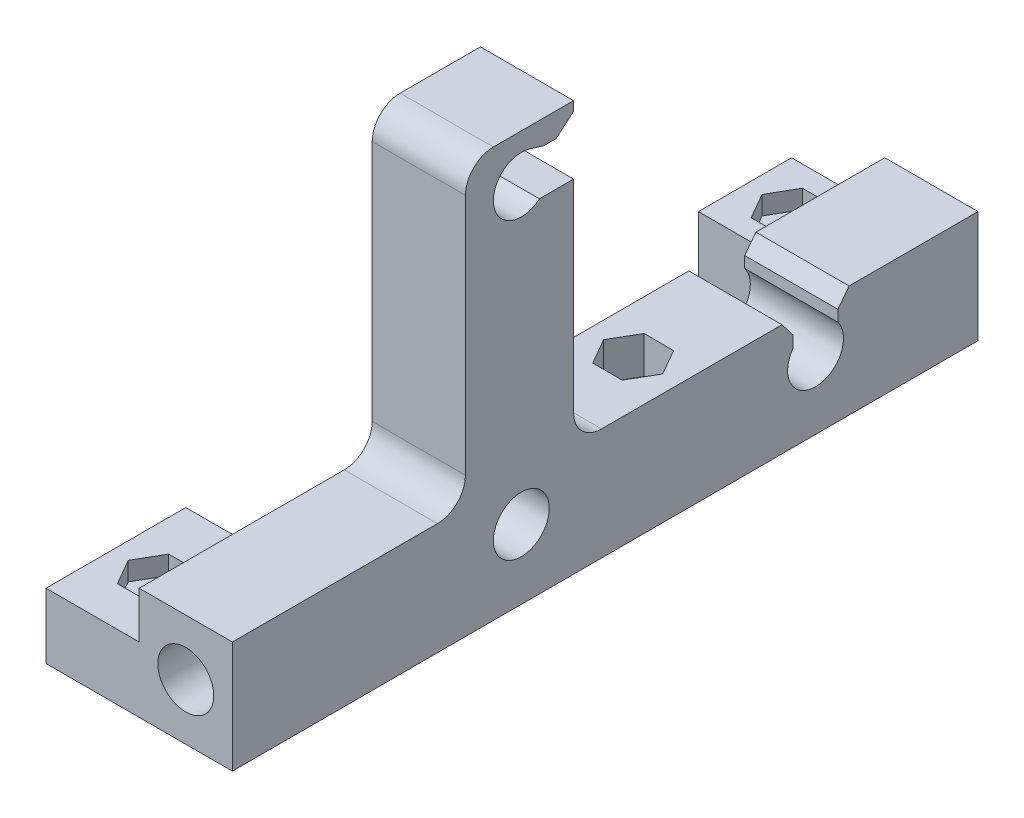
from build123d import *

# Parameters (mm, degrees)
ESBO_O1_R                          = 3
RESSALTO_EXTRUS_O1_DEPTH           = 10
ESBO_O2_R                          = 3
CORTE_EXTRUS_O1_DEPTH              = 20
CORTE_EXTRUS_O2_START              = -70
ESBO_O2_2_R                        = 3
CORTE_EXTRUS_O2_DEPTH              = 10
FILETE1_R                          = 3
ESBO_O3_W                          = 15
ESBO_O3_H                          = 12
ESBO_O3_W_2                        = 10
RESSALTO_EXTRUS_O2_DEPTH           = 10
ESBO_O4_R                          = 1.5
CORTE_EXTRUS_O3_DEPTH              = 15
PADR_O_LINEAR1_COUNT               = 2
PADR_O_LINEAR1_PITCH               = 68
ESBO_O5_R                          = 3
CORTE_EXTRUS_O4_DEPTH              = 63.737548565
CORPO_MOVER_COPIAR1_OUTLINE_R      = 3
CORPO_MOVER_COPIAR1_DEPTH          = 10
CORPO_MOVER_COPIAR1_START          = -10
CORPO_MOVER_COPIAR1_2_OUTLINE_W    = 12
CORPO_MOVER_COPIAR1_2_OUTLINE_H    = 5
CORPO_MOVER_COPIAR1_2_DEPTH        = 11.9999999
CORPO_MOVER_COPIAR1_START_2        = 7.999555429
CORPO_MOVER_COPIAR1_3_DEPTH        = 2.000444571
CORPO_MOVER_COPIAR1_4_DEPTH        = 1.9999999
CORPO_MOVER_COPIAR1_START_3        = -15
CORPO_MOVER_COPIAR1_5_OUTLINE_W    = 10
CORPO_MOVER_COPIAR1_5_OUTLINE_H    = 12
CORPO_MOVER_COPIAR1_5_DEPTH        = 11.608984939
CORPO_MOVER_COPIAR1_START_4        = 15
CORPO_MOVER_COPIAR1_6_OUTLINE_W    = 10
CORPO_MOVER_COPIAR1_6_OUTLINE_H    = 12
CORPO_MOVER_COPIAR1_6_OUTLINE_R    = 3
CORPO_MOVER_COPIAR1_6_DEPTH        = 11.17
CORPO_MOVER_COPIAR1_START_5        = 25
CORPO_MOVER_COPIAR1_7_OUTLINE_W    = 10
CORPO_MOVER_COPIAR1_7_OUTLINE_H    = 12
CORPO_MOVER_COPIAR1_7_DEPTH        = 5
CORPO_MOVER_COPIAR1_START_6        = -30
CORPO_MOVER_COPIAR1_8_OUTLINE_R    = 3
CORPO_MOVER_COPIAR1_8_DEPTH        = 3.5411
CORPO_MOVER_COPIAR1_START_7        = 19.57
CORPO_MOVER_COPIAR1_9_OUTLINE_R    = 3
CORPO_MOVER_COPIAR1_9_DEPTH        = 0.43
CORPO_MOVER_COPIAR1_10_OUTLINE_W   = 10
CORPO_MOVER_COPIAR1_10_OUTLINE_H   = 5
CORPO_MOVER_COPIAR1_10_DEPTH       = 12
CORPO_MOVER_COPIAR1_11_OUTLINE_R   = 3
CORPO_MOVER_COPIAR1_11_DEPTH       = 20
CORPO_MOVER_COPIAR1_12_DEPTH       = 10
CORPO_MOVER_COPIAR1_13_OUTLINE_W   = 10
CORPO_MOVER_COPIAR1_13_OUTLINE_H   = 12
CORPO_MOVER_COPIAR1_13_OUTLINE_H_2 = 32
CORPO_MOVER_COPIAR1_13_DEPTH       = 26.608984939
CORPO_MOVER_COPIAR1_START_8        = 20
CORPO_MOVER_COPIAR1_14_OUTLINE_R   = 3
CORPO_MOVER_COPIAR1_14_DEPTH       = 10
CORPO_MOVER_COPIAR1_15_OUTLINE_W   = 10
CORPO_MOVER_COPIAR1_15_OUTLINE_H   = 5
CORPO_MOVER_COPIAR1_15_DEPTH       = 12
CORTE_EXTRUS_O5_START              = -5
ESBO_O6_W                          = 10
ESBO_O6_H                          = 15
ESBO_O6_H_2                        = 10
ESBO_O6_R                          = 1.5
CORTE_EXTRUS_O5_DEPTH              = 5
CORTE_EXTRUS_O6_START              = -7
ESBO_O6_3_R                        = 1.5
CORTE_EXTRUS_O6_DEPTH              = 7
ESBO_O7_R                          = 1.5
CORTE_EXTRUS_O7_DEPTH              = 53.191953422
ESBO_O7_3_R                        = 1.5
CORTE_EXTRUS_O8_DEPTH              = 4


# Read off the part's stored shape, not the designer's step: Corpo-Mover/Copiar1
with BuildPart() as part:
    # Esboço1 → Ressalto-extrusão1 (new body)
    with BuildSketch(Plane(origin=(0, 0, 0), x_dir=(0, 0, -1), z_dir=(1, 0, 0))):
        with BuildLine():
            Line((15, 44), (3.391015061, 44))
            Line((3.391015061, 44), (3.391015061, 43.011133206))
            Line((3.391015061, 43.011133206), (5.263619021, 41.411133206))
            Line((5.263619021, 41.411133206), (6.571620064, 41.411133206))
            Line((6.571620064, 41.411133206), (8.150645936, 41.877255233))
            ThreePointArc((8.150645936, 41.877255233), (11.934972998, 38.378764538), (7.057683257, 36.713647956))
            Line((7.057683257, 36.713647956), (3.391015061, 36.713647956))
            Line((3.391015061, 36.713647956), (3.391015061, 12))
            Line((3.391015061, 12), (-40, 12))
            Line((-40, 12), (-40, 0))
            Line((-40, 0), (40, 0))
            Line((40, 0), (40, 12))
            Line((40, 12), (15, 12))
            Line((15, 12), (15, 44))
        make_face()
        with Locations((9, 7.43)):
            Circle(ESBO_O1_R, mode=Mode.SUBTRACT)
    extrude(amount=RESSALTO_EXTRUS_O1_DEPTH)

    # Esboço2 → Corte-extrusão1 (cut)
    with BuildSketch(Plane(origin=(0, 0, -40), x_dir=(-1, 0, 0), z_dir=(0, 0, -1))):
        with Locations((-5, 6)):
            Circle(ESBO_O2_R)
    extrude(amount=-CORTE_EXTRUS_O1_DEPTH, mode=Mode.SUBTRACT)

    # Esboço2<2> → Corte-extrusão2 (cut)
    with BuildSketch(Plane(origin=(0, 0, -40), x_dir=(-1, 0, 0), z_dir=(0, 0, -1)).offset(CORTE_EXTRUS_O2_START)):
        with Locations((-5, 6)):
            Circle(ESBO_O2_2_R)
    extrude(amount=-CORTE_EXTRUS_O2_DEPTH, mode=Mode.SUBTRACT)

    # Filete1
    filete1_edges = [part.edges().sort_by_distance(p)[0] for p in [
        (5, 12, -3.391015061),
        (5, 44, -15),
        (5, 12, -15),
    ]]
    fillet(filete1_edges, radius=FILETE1_R)

    # Esboço3 → Ressalto-extrusão2 (add)
    with BuildSketch(Plane.ZY):
        with Locations((-32.5, 6)):
            Rectangle(ESBO_O3_W, ESBO_O3_H)
        with Locations((35, 6)):
            Rectangle(ESBO_O3_W_2, ESBO_O3_H)
    extrude(amount=RESSALTO_EXTRUS_O2_DEPTH)

    # Esboço4 → Corte-extrusão3 (cut)
    with BuildSketch(Plane(origin=(0, 12, 0), x_dir=(1, 0, 0), z_dir=(0, 1, 0))):
        with Locations(Location((-5, 33, 0), (0, 0, 270))):
            Circle(ESBO_O4_R)
    corte_extrus_o3 = extrude(amount=-CORTE_EXTRUS_O3_DEPTH, mode=Mode.SUBTRACT)

    # Padrão linear1: Corte-extrusão3 ×2
    with Locations(*[(0, 0, i * PADR_O_LINEAR1_PITCH) for i in range(1, PADR_O_LINEAR1_COUNT)]):
        add(corte_extrus_o3, mode=Mode.SUBTRACT)

    # Esboço5 → Corte-extrusão4 (cut, through all)
    with BuildSketch(Plane(origin=(10, 0, 0), x_dir=(0, 0, -1), z_dir=(1, 0, 0))):
        with Locations((-22.57, 7.43)):
            Circle(ESBO_O5_R)
        with BuildLine():
            Line((-18.97, 12), (-26.17, 12))
            Line((-26.17, 12), (-24.97, 10.43))
            Line((-24.97, 10.43), (-24.97, 9.23))
            ThreePointArc((-24.97, 9.23), (-22.57, 10.43), (-20.17, 9.23))
            Line((-20.17, 9.23), (-20.17, 10.43))
            Line((-20.17, 10.43), (-18.97, 12))
        make_face()
    extrude(amount=-CORTE_EXTRUS_O4_DEPTH, mode=Mode.SUBTRACT)

    # Corpo-Mover/Copiar1 outline → Corpo-Mover/Copiar1 (add)
    # profile 1 of 2: a face of its own
    with BuildSketch(Plane.YZ):
        with BuildLine():
            ThreePointArc((15, 15), (12.878679656, 15.878679656), (12, 18))
            Line((12, 18), (12, 18.97))
            Line((12, 18.97), (10.43, 20.17))
            Line((10.43, 20.17), (9.23, 20.17))
            ThreePointArc((9.23, 20.17), (5.014914218, 20.790291972), (5.670710371, 25))
            Line((5.670710371, 25), (0, 25))
            Line((0, 25), (0, -30))
            Line((0, -30), (12, -30))
            Line((12, -30), (12, -26.17))
            Line((12, -26.17), (10.46925, -25))
            Line((10.46925, -25), (9.189289629, -25))
            ThreePointArc((9.189289629, -25), (4.927760612, -24.224931432), (5.882388938, -20))
            ThreePointArc((5.882388938, -20), (7.43, -19.57), (8.977611062, -20))
            ThreePointArc((8.977611062, -20), (9.105962397, -20.081797829), (9.23, -20.17))
            Line((9.23, -20.17), (10.43, -20.17))
            Line((10.43, -20.17), (12, -18.97))
            Line((12, -18.97), (12, 0.391015061))
            ThreePointArc((12, 0.391015061), (12.878679656, 2.512335405), (15, 3.391015061))
            Line((15, 3.391015061), (36.713647956, 3.391015061))
            Line((36.713647956, 3.391015061), (36.713647956, 7.057683257))
            ThreePointArc((36.713647956, 7.057683257), (38.378764539, 11.934972998), (41.877255233, 8.150645936))
            Line((41.877255233, 8.150645936), (41.411133206, 6.571620064))
            Line((41.411133206, 6.571620064), (41.411133206, 5.263619021))
            Line((41.411133206, 5.263619021), (43.011133206, 3.391015061))
            Line((43.011133206, 3.391015061), (44, 3.391015061))
            Line((44, 3.391015061), (44, 12))
            ThreePointArc((44, 12), (43.121320344, 14.121320344), (41, 15))
            Line((41, 15), (15, 15))
        make_face()
        with Locations((7.43, 9)):
            Circle(CORPO_MOVER_COPIAR1_OUTLINE_R, mode=Mode.SUBTRACT)
    # profile 2 of 2: a face of its own
    with BuildSketch(Plane.YZ):
        Polygon((10.46925, 25), (12, 25), (12, 26.17), align=None)
    extrude(amount=CORPO_MOVER_COPIAR1_DEPTH)

    # Corpo-Mover_Copiar1 2 outline → Corpo-Mover_Copiar1 2 (add)
    with BuildSketch(Plane.YZ.offset(CORPO_MOVER_COPIAR1_START)):
        with Locations((6, 27.5)):
            Rectangle(CORPO_MOVER_COPIAR1_2_OUTLINE_W, CORPO_MOVER_COPIAR1_2_OUTLINE_H)
    extrude(amount=CORPO_MOVER_COPIAR1_2_DEPTH)

    # Corpo-Mover_Copiar1 3 outline → Corpo-Mover_Copiar1 3 (add)
    with BuildSketch(Plane.YZ.offset(CORPO_MOVER_COPIAR1_START_2)):
        with BuildLine():
            Line((10.43, 20.17), (12, 18.97))
            Line((12, 18.97), (12, 25))
            Line((12, 25), (10.46925, 25))
            Line((10.46925, 25), (10.43, 24.97))
            Line((10.43, 24.97), (9.23, 24.97))
            ThreePointArc((9.23, 24.97), (4.43, 22.57), (9.23, 20.17))
            Line((9.23, 20.17), (10.43, 20.17))
        make_face()
    extrude(amount=CORPO_MOVER_COPIAR1_3_DEPTH)

    # Corpo-Mover_Copiar1 4 outline → Corpo-Mover_Copiar1 4 (add)
    with BuildSketch(Plane.YZ):
        with BuildLine():
            Line((10.43, 20.17), (12, 18.97))
            Line((12, 18.97), (12, 25))
            Line((12, 25), (10.46925, 25))
            Line((10.46925, 25), (10.43, 24.97))
            Line((10.43, 24.97), (9.23, 24.97))
            ThreePointArc((9.23, 24.97), (9.209708028, 24.985085782), (9.189289629, 25))
            Line((9.189289629, 25), (5.670710371, 25))
            ThreePointArc((5.670710371, 25), (5.014914218, 20.790291972), (9.23, 20.17))
            Line((9.23, 20.17), (10.43, 20.17))
        make_face()
    extrude(amount=CORPO_MOVER_COPIAR1_4_DEPTH)

    # Corpo-Mover_Copiar1 5 outline → Corpo-Mover_Copiar1 5 (add)
    with BuildSketch(Plane.XY.offset(CORPO_MOVER_COPIAR1_START_3)):
        with Locations((5, 6)):
            Rectangle(CORPO_MOVER_COPIAR1_5_OUTLINE_W, CORPO_MOVER_COPIAR1_5_OUTLINE_H)
    extrude(amount=CORPO_MOVER_COPIAR1_5_DEPTH)

    # Corpo-Mover_Copiar1 6 outline → Corpo-Mover_Copiar1 6 (add)
    with BuildSketch(Plane.XY.offset(CORPO_MOVER_COPIAR1_START_4)):
        with Locations((5, 6)):
            Rectangle(CORPO_MOVER_COPIAR1_6_OUTLINE_W, CORPO_MOVER_COPIAR1_6_OUTLINE_H)
        with Locations((5, 6)):
            Circle(CORPO_MOVER_COPIAR1_6_OUTLINE_R, mode=Mode.SUBTRACT)
    extrude(amount=CORPO_MOVER_COPIAR1_6_DEPTH)

    # Corpo-Mover_Copiar1 7 outline → Corpo-Mover_Copiar1 7 (add)
    with BuildSketch(Plane.XY.offset(CORPO_MOVER_COPIAR1_START_5)):
        with Locations((-5, 6)):
            Rectangle(CORPO_MOVER_COPIAR1_7_OUTLINE_W, CORPO_MOVER_COPIAR1_7_OUTLINE_H)
    extrude(amount=CORPO_MOVER_COPIAR1_7_DEPTH)

    # Corpo-Mover_Copiar1 8 outline → Corpo-Mover_Copiar1 8 (add)
    with BuildSketch(Plane.XY.offset(CORPO_MOVER_COPIAR1_START_6)):
        with Locations((5, 6)):
            Circle(CORPO_MOVER_COPIAR1_8_OUTLINE_R)
    extrude(amount=CORPO_MOVER_COPIAR1_8_DEPTH)

    # Corpo-Mover_Copiar1 9 outline → Corpo-Mover_Copiar1 9 (add)
    with BuildSketch(Plane.XY.offset(CORPO_MOVER_COPIAR1_START_7)):
        with Locations((5, 6)):
            Circle(CORPO_MOVER_COPIAR1_9_OUTLINE_R)
    extrude(amount=CORPO_MOVER_COPIAR1_9_DEPTH)

    # Corpo-Mover_Copiar1 10 outline → Corpo-Mover_Copiar1 10 (add)
    with BuildSketch(Plane(origin=(0, 0, 0), x_dir=(1, 0, 0), z_dir=(0, 1, 0))):
        with BuildLine():
            ThreePointArc((-3.881966011, -34), (-5, -34.5), (-6.118033989, -34))
            ThreePointArc((-6.118033989, -34), (-5, -36.5), (-3.881966011, -34))
        make_face()
        with BuildLine():
            ThreePointArc((-3.881966011, 34), (-5, 33.5), (-6.118033989, 34))
            ThreePointArc((-6.118033989, 34), (-5, 31.5), (-3.881966011, 34))
        make_face()
        with Locations((-5, -27.5)):
            Rectangle(CORPO_MOVER_COPIAR1_10_OUTLINE_W, CORPO_MOVER_COPIAR1_10_OUTLINE_H)
    extrude(amount=CORPO_MOVER_COPIAR1_10_DEPTH)

    # Corpo-Mover_Copiar1 11 outline → Corpo-Mover_Copiar1 11 (cut)
    with BuildSketch(Plane.YZ.offset(CORPO_MOVER_COPIAR1_START)):
        with BuildLine():
            ThreePointArc((15, -3.391015061), (12.878679656, -2.512335405), (12, -0.391015061))
            Line((12, -0.391015061), (12, -18))
            ThreePointArc((12, -18), (12.878679656, -15.878679656), (15, -15))
            Line((15, -15), (41, -15))
            ThreePointArc((41, -15), (43.121320344, -14.121320344), (44, -12))
            Line((44, -12), (44, -3.391015061))
            Line((44, -3.391015061), (43.011133206, -3.391015061))
            Line((43.011133206, -3.391015061), (41.411133206, -5.263619021))
            Line((41.411133206, -5.263619021), (41.411133206, -6.571620064))
            Line((41.411133206, -6.571620064), (41.877255233, -8.150645936))
            ThreePointArc((41.877255233, -8.150645936), (38.378764539, -11.934972998), (36.713647956, -7.057683257))
            Line((36.713647956, -7.057683257), (36.713647956, -3.391015061))
            Line((36.713647956, -3.391015061), (15, -3.391015061))
        make_face()
        with BuildLine():
            Line((12, -18.97), (10.43, -20.17))
            Line((10.43, -20.17), (9.23, -20.17))
            ThreePointArc((9.23, -20.17), (4.43, -22.57), (9.23, -24.97))
            Line((9.23, -24.97), (10.43, -24.97))
            Line((10.43, -24.97), (12, -26.17))
            Line((12, -26.17), (12, -18.97))
        make_face()
        with Locations((7.43, 9)):
            Circle(CORPO_MOVER_COPIAR1_11_OUTLINE_R)
    extrude(amount=CORPO_MOVER_COPIAR1_11_DEPTH, mode=Mode.SUBTRACT)

    # Corpo-Mover_Copiar1 12 outline → Corpo-Mover_Copiar1 12 (cut)
    with BuildSketch(Plane.YZ.offset(CORPO_MOVER_COPIAR1_START)):
        with BuildLine():
            Line((12, -30), (12, -26.17))
            Line((12, -26.17), (10.46925, -25))
            Line((10.46925, -25), (9.189289629, -25))
            ThreePointArc((9.189289629, -25), (7.43, -25.57), (5.670710371, -25))
            Line((5.670710371, -25), (0, -25))
            Line((0, -25), (0, -30))
            Line((0, -30), (12, -30))
        make_face()
    extrude(amount=CORPO_MOVER_COPIAR1_12_DEPTH, mode=Mode.SUBTRACT)

    # Corpo-Mover_Copiar1 13 outline → Corpo-Mover_Copiar1 13 (cut)
    with BuildSketch(Plane.XY.offset(CORPO_MOVER_COPIAR1_START_6)):
        with Locations((-5, 6)):
            Rectangle(CORPO_MOVER_COPIAR1_13_OUTLINE_W, CORPO_MOVER_COPIAR1_13_OUTLINE_H)
        with Locations((5, 28)):
            Rectangle(CORPO_MOVER_COPIAR1_13_OUTLINE_W, CORPO_MOVER_COPIAR1_13_OUTLINE_H_2)
    extrude(amount=CORPO_MOVER_COPIAR1_13_DEPTH, mode=Mode.SUBTRACT)

    # Corpo-Mover_Copiar1 14 outline → Corpo-Mover_Copiar1 14 (cut)
    with BuildSketch(Plane.XY.offset(CORPO_MOVER_COPIAR1_START_8)):
        with Locations((5, 6)):
            Circle(CORPO_MOVER_COPIAR1_14_OUTLINE_R)
    extrude(amount=CORPO_MOVER_COPIAR1_14_DEPTH, mode=Mode.SUBTRACT)

    # Corpo-Mover_Copiar1 15 outline → Corpo-Mover_Copiar1 15 (cut)
    with BuildSketch(Plane(origin=(0, 0, 0), x_dir=(1, 0, 0), z_dir=(0, 1, 0))):
        with BuildLine():
            ThreePointArc((-3.881966011, -34), (-5, -31.5), (-6.118033989, -34))
            ThreePointArc((-6.118033989, -34), (-5, -33.5), (-3.881966011, -34))
        make_face()
        with BuildLine():
            ThreePointArc((-3.881966011, 34), (-5, 36.5), (-6.118033989, 34))
            ThreePointArc((-6.118033989, 34), (-5, 34.5), (-3.881966011, 34))
        make_face()
        with Locations((-5, 27.5)):
            Rectangle(CORPO_MOVER_COPIAR1_15_OUTLINE_W, CORPO_MOVER_COPIAR1_15_OUTLINE_H)
    extrude(amount=CORPO_MOVER_COPIAR1_15_DEPTH, mode=Mode.SUBTRACT)

    # Esboço6 → Corte-extrusão5 (cut)
    # profile 1 of 4: a face of its own
    with BuildSketch(Plane(origin=(0, 12, 0), x_dir=(1, 0, 0), z_dir=(0, 1, 0)).offset(CORTE_EXTRUS_O5_START)):
        with Locations((-5, -32.5)):
            Rectangle(ESBO_O6_W, ESBO_O6_H)
        Polygon((-6.58771324, -35.75), (-3.41228676, -35.75), (-1.824573519, -33), (-3.41228676, -30.25), (-6.58771324, -30.25), (-8.175426481, -33), align=None, mode=Mode.SUBTRACT)
    # profile 2 of 4: a face of its own
    with BuildSketch(Plane(origin=(0, 12, 0), x_dir=(1, 0, 0), z_dir=(0, 1, 0)).offset(CORTE_EXTRUS_O5_START)):
        Polygon((-8.175426481, -33), (-6.58771324, -35.75), (-3.41228676, -35.75), (-1.824573519, -33), (-3.41228676, -30.25), (-6.58771324, -30.25), align=None)
    # profile 3 of 4: a face of its own
    with BuildSketch(Plane(origin=(0, 12, 0), x_dir=(1, 0, 0), z_dir=(0, 1, 0)).offset(CORTE_EXTRUS_O5_START)):
        with Locations((-5, 35)):
            Rectangle(ESBO_O6_W, ESBO_O6_H_2)
        Polygon((-1.824573519, 35), (-3.41228676, 32.25), (-6.58771324, 32.25), (-8.175426481, 35), (-6.58771324, 37.75), (-3.41228676, 37.75), align=None, mode=Mode.SUBTRACT)
    # profile 4 of 4: a face of its own
    with BuildSketch(Plane(origin=(0, 12, 0), x_dir=(1, 0, 0), z_dir=(0, 1, 0)).offset(CORTE_EXTRUS_O5_START)):
        Polygon((-8.175426481, 35), (-6.58771324, 32.25), (-3.41228676, 32.25), (-1.824573519, 35), (-3.41228676, 37.75), (-6.58771324, 37.75), align=None)
        with Locations(Location((-5, 35, 0), (0, 0, 90))):
            Circle(ESBO_O6_R, mode=Mode.SUBTRACT)
    extrude(amount=CORTE_EXTRUS_O5_DEPTH, mode=Mode.SUBTRACT)

    # Esboço6<3> → Corte-extrusão6 (cut)
    # profile 1 of 2: a face of its own
    with BuildSketch(Plane(origin=(0, 12, 0), x_dir=(1, 0, 0), z_dir=(0, 1, 0)).offset(CORTE_EXTRUS_O6_START)):
        Polygon((-8.175426481, 35), (-6.58771324, 32.25), (-3.41228676, 32.25), (-1.824573519, 35), (-3.41228676, 37.75), (-6.58771324, 37.75), align=None)
        with Locations(Location((-5, 35, 0), (0, 0, 90))):
            Circle(ESBO_O6_3_R, mode=Mode.SUBTRACT)
    # profile 2 of 2: a face of its own
    with BuildSketch(Plane(origin=(0, 12, 0), x_dir=(1, 0, 0), z_dir=(0, 1, 0)).offset(CORTE_EXTRUS_O6_START)):
        Polygon((-8.175426481, -33), (-6.58771324, -35.75), (-3.41228676, -35.75), (-1.824573519, -33), (-3.41228676, -30.25), (-6.58771324, -30.25), align=None)
    extrude(amount=CORTE_EXTRUS_O6_DEPTH, mode=Mode.SUBTRACT)

    # Esboço7 → Corte-extrusão7 (cut, through all)
    with BuildSketch(Plane(origin=(0, 12, 0), x_dir=(1, 0, 0), z_dir=(0, 1, 0))):
        with Locations(Location((5, 8, 0), (0, 0, 270))):
            Circle(ESBO_O7_R)
    extrude(amount=-CORTE_EXTRUS_O7_DEPTH, mode=Mode.SUBTRACT)

    # Esboço7<3> → Corte-extrusão8 (cut)
    with BuildSketch(Plane(origin=(0, 12, 0), x_dir=(1, 0, 0), z_dir=(0, 1, 0))):
        Polygon((6.574423029, 5.242369593), (8.175389501, 7.984675136), (6.600966472, 10.742305542), (3.425576971, 10.757630407), (1.824610499, 8.015324864), (3.399033528, 5.257694458), align=None)
        with Locations(Location((5, 8, 0), (0, 0, 270))):
            Circle(ESBO_O7_3_R, mode=Mode.SUBTRACT)
    extrude(amount=-CORTE_EXTRUS_O8_DEPTH, mode=Mode.SUBTRACT)


solid = part.part
